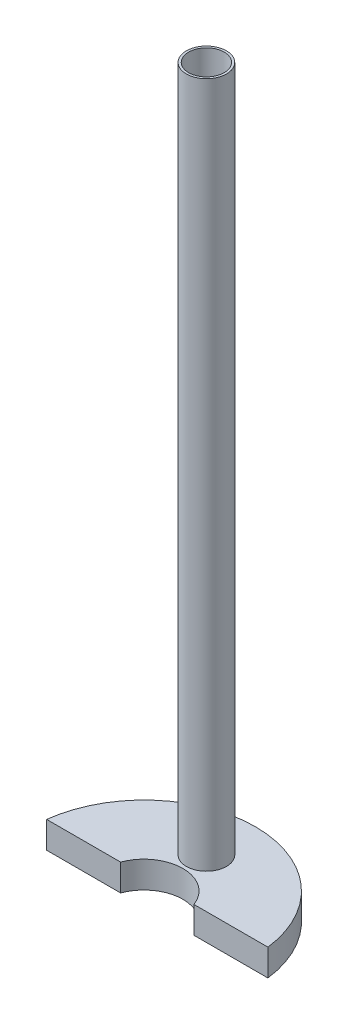
from build123d import *

# Parameters (mm, degrees)
BASEPLATEV2_DEPTH       = 3
SKETCH11_14_R           = 2.25
RODV2_DEPTH             = 80
CUT_EXTRUDE1_DEPTH      = 82.916115631
CUT_EXTRUDE1_DEPTH_BACK = 82.916115631
SKETCH14_R              = 2


with BuildPart() as part:
    # Sketch11 → BasePlateV2 (new body)
    with BuildSketch(Plane(origin=(0, 0, 0), x_dir=(1, 0, 0), z_dir=(0, 1, 0))):
        with BuildLine():
            ThreePointArc((12.409673646, 1.5), (0, 12.5), (-12.409673646, 1.5))
            Line((-12.409673646, 1.5), (-4.109820556, 1.5))
            ThreePointArc((-4.109820556, 1.5), (0, 4.375), (4.109820556, 1.5))
            Line((4.109820556, 1.5), (12.409673646, 1.5))
        make_face()
    extrude(amount=BASEPLATEV2_DEPTH)

    # Sketch11<14> → RodV2 (add)
    with BuildSketch(Plane(origin=(0, 0, 0), x_dir=(1, 0, 0), z_dir=(0, 1, 0))):
        with Locations((0, 7.011085481)):
            Circle(SKETCH11_14_R)
    extrude(amount=RODV2_DEPTH)

    # Sketch14 → Cut-Extrude1 (cut, two sides: drawn at the far end of the back side and taken through both)
    with BuildSketch(Plane(origin=(0, 80, 0), x_dir=(1, 0, 0), z_dir=(0, 1, 0)).offset(-CUT_EXTRUDE1_DEPTH_BACK)):
        with Locations((0, 7.011085481)):
            Circle(SKETCH14_R)
    extrude(amount=CUT_EXTRUDE1_DEPTH + CUT_EXTRUDE1_DEPTH_BACK, mode=Mode.SUBTRACT)


solid = part.part
